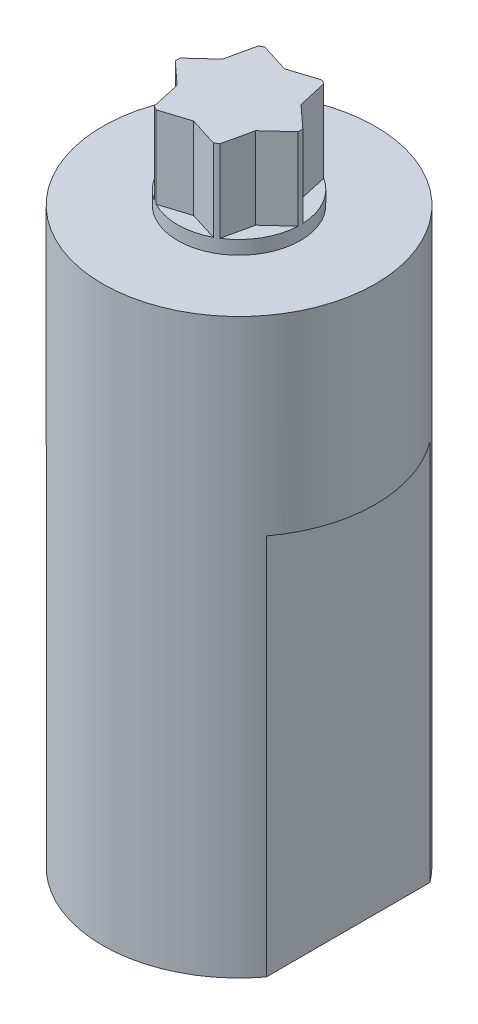
from build123d import *

# Parameters (mm, degrees)
SKETCH1_R           = 5
BOSS_EXTRUDE1_DEPTH = 7
BOSS_EXTRUDE2_START = -14
BOSS_EXTRUDE2_DEPTH = 14
SKETCH3_R           = 2.25
BOSS_EXTRUDE3_DEPTH = 3.5
CUT_EXTRUDE1_DEPTH  = 3
CIRPATTERN1_COUNT   = 6


with BuildPart() as part:
    # Sketch1 → Boss-Extrude1 (new body)
    with BuildSketch(Plane(origin=(0, 0, 0), x_dir=(1, 0, 0), z_dir=(0, 1, 0))):
        Circle(SKETCH1_R)
    extrude(amount=BOSS_EXTRUDE1_DEPTH)

    # Sketch2 → Boss-Extrude2 (add)
    with BuildSketch(Plane(origin=(0, 0, 0), x_dir=(1, 0, 0), z_dir=(0, 1, 0)).offset(BOSS_EXTRUDE2_START)):
        with BuildLine():
            Line((-4, 3), (-4, -3))
            ThreePointArc((-4, -3), (0, -5), (4, -3))
            Line((4, -3), (4, 3))
            ThreePointArc((4, 3), (0, 5), (-4, 3))
        make_face()
    extrude(amount=BOSS_EXTRUDE2_DEPTH)

    # Sketch3 → Boss-Extrude3 (add)
    with BuildSketch(Plane(origin=(0, 7, 0), x_dir=(1, 0, 0), z_dir=(0, 1, 0))):
        Circle(SKETCH3_R)
    extrude(amount=BOSS_EXTRUDE3_DEPTH)

    # Sketch4 → Cut-Extrude1 (cut)
    with BuildSketch(Plane(origin=(0, 10.5, 0), x_dir=(1, 0, 0), z_dir=(0, 1, 0))):
        Polygon((0, 1.662498522), (-5.909749561, 3.521754474), (5.909749561, 3.521754474), align=None)
    cut_extrude1 = extrude(amount=-CUT_EXTRUDE1_DEPTH, mode=Mode.SUBTRACT)

    # CirPattern1: Cut-Extrude1 ×6 about axis
    cirpattern1_axis = Axis((0, 7, 0), (0, 1, 0))
    for i in range(1, CIRPATTERN1_COUNT):
        add(cut_extrude1.rotate(cirpattern1_axis, i * 360 / CIRPATTERN1_COUNT), mode=Mode.SUBTRACT)


solid = part.part
